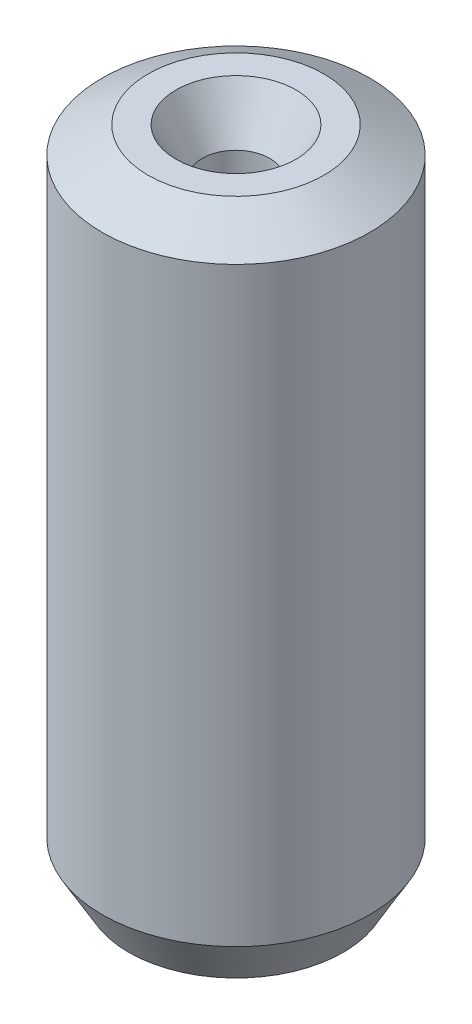
from build123d import *
from OCP.BRepFilletAPI import BRepFilletAPI_MakeChamfer

# Parameters (mm, degrees)
SKETCH1_R           = 5
BOSS_EXTRUDE1_DEPTH = 24.786743243
SKETCH2_R           = 1.253904742
CUT_EXTRUDE1_DEPTH  = 26.775621051
CHAMFER1_SIZE       = 0.990861267
CHAMFER1_SIZE2      = 1.716222057


with BuildPart() as part:
    # Sketch1 → Boss-Extrude1 (new body)
    with BuildSketch(Plane(origin=(0, 0, 0), x_dir=(1, 0, 0), z_dir=(0, 1, 0))):
        Circle(SKETCH1_R)
    extrude(amount=BOSS_EXTRUDE1_DEPTH)

    # Sketch2 → Cut-Extrude1 (cut, through all)
    with BuildSketch(Plane(origin=(0, 0, 0), x_dir=(1, 0, 0), z_dir=(0, 1, 0))):
        Circle(SKETCH2_R)
    extrude(amount=CUT_EXTRUDE1_DEPTH, mode=Mode.SUBTRACT)

    # Chamfer1: one chamfer whose edges measure the first distance from different faces: ONE call of the kernel's chamfer builder (chamfer() names one face for all edges)
    chamfer1_edges_1 = [part.edges().sort_by_distance(p)[0] for p in [
        (-1.253904742, 24.786743243, 0),
    ]]
    chamfer1_side_1 = [part.faces().sort_by_distance(p)[0] for p in [
        (-4.858578644, 24.786743243, 0),
    ]]
    chamfer1_edges_2 = [part.edges().sort_by_distance(p)[0] for p in [
        (-1.253904742, 0, 0),
    ]]
    chamfer1_side_2 = [part.faces().sort_by_distance(p)[0] for p in [
        (-1.253904742, 12.393371621, 0),
    ]]
    chamfer1_edges_3 = [part.edges().sort_by_distance(p)[0] for p in [
        (-5, 0, 0),
    ]]
    chamfer1_side_3 = [part.faces().sort_by_distance(p)[0] for p in [
        (-4.858578644, 0, 0),
    ]]
    chamfer1_edges_4 = [part.edges().sort_by_distance(p)[0] for p in [
        (-5, 24.786743243, 0),
    ]]
    chamfer1_side_4 = [part.faces().sort_by_distance(p)[0] for p in [
        (-5, 12.393371621, 0),
    ]]
    chamfer1 = BRepFilletAPI_MakeChamfer(part.part.solid().wrapped)
    for e in chamfer1_edges_1:
        chamfer1.Add(CHAMFER1_SIZE, CHAMFER1_SIZE2, e.wrapped, chamfer1_side_1[0].wrapped)  # the first distance lies on this face
    for e in chamfer1_edges_2:
        chamfer1.Add(CHAMFER1_SIZE, CHAMFER1_SIZE2, e.wrapped, chamfer1_side_2[0].wrapped)  # the first distance lies on this face
    for e in chamfer1_edges_3:
        chamfer1.Add(CHAMFER1_SIZE, CHAMFER1_SIZE2, e.wrapped, chamfer1_side_3[0].wrapped)  # the first distance lies on this face
    for e in chamfer1_edges_4:
        chamfer1.Add(CHAMFER1_SIZE, CHAMFER1_SIZE2, e.wrapped, chamfer1_side_4[0].wrapped)  # the first distance lies on this face
    add(Compound.cast(chamfer1.Shape()), mode=Mode.REPLACE)


solid = part.part
